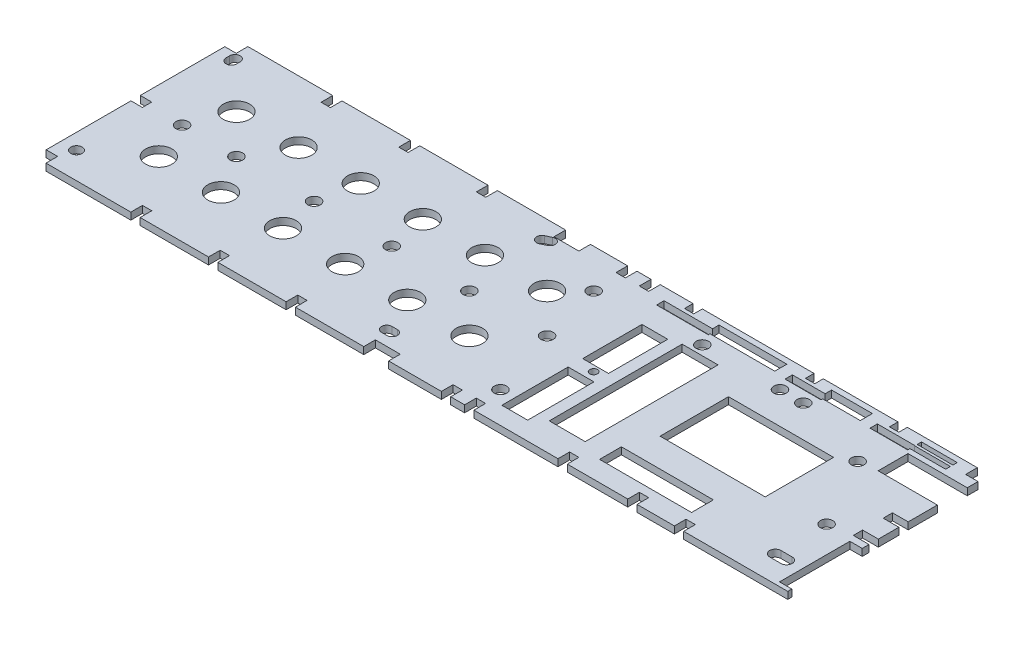
from build123d import *

# Parameters (mm, degrees)
SKETCH1_R           = 3.625773575
SKETCH1_R_2         = 8.5
SKETCH1_R_3         = 4
SKETCH1_W           = 59.227902108
SKETCH1_H           = 14.048666808
SKETCH1_W_2         = 16.602969863
SKETCH1_H_2         = 42.683012068
SKETCH1_R_4         = 2.466961033
SKETCH1_W_3         = 23.148371443
SKETCH1_H_3         = 85.569152371
SKETCH1_H_4         = 38.143470965
SKETCH1_W_4         = 67.68903098
SKETCH1_H_5         = 44.061727713
SKETCH1_W_5         = 22.994184748
SKETCH1_H_6         = 2.807717578
BOSS_EXTRUDE1_DEPTH = 4.5


with BuildPart() as part:
    # Sketch1 → Boss-Extrude1 (new body)
    with BuildSketch(Plane(origin=(0, 0, 0), x_dir=(1, 0, 0), z_dir=(0, 1, 0))):
        Polygon((62.002732312, 130), (7.385469745, 130), (7.385469745, 122.5), (0, 122.5), (0, 68.086598687), (7.385469745, 68.086598687), (7.385469745, 62.086598687), (0, 62.086598687), (0, 7.5), (7.385469745, 7.5), (7.385469745, 0), (62.002732312, 0), (62.002732312, 7.5), (68.002732312, 7.5), (68.002732312, 0), (112.032509858, 0), (112.032509858, 7.5), (118.032509858, 7.5), (118.032509858, 0), (161.992021545, 0), (161.992021545, 7.5), (167.992021545, 7.5), (167.992021545, 0), (211.980665765, 0), (211.980665765, 7.5), (227.980665765, 7.5), (227.980665765, 0), (261.969584498, 0), (261.969584498, 7.5), (267.969584498, 7.5), (267.969584498, 0), (276.920755035, 0), (276.920755035, 7.5), (282.920755035, 7.5), (282.920755035, 0), (337.020889406, 0), (337.020889406, 7.5), (343.020889406, 7.5), (343.020889406, 0), (381.96318409, 0), (381.96318409, 7.5), (387.96318409, 7.5), (387.96318409, 0), (411.996997426, 0), (411.996997426, 7.5), (417.996997426, 7.5), (417.996997426, 0), (485, 0), (485, 2.644509449), (477.041499419, 2.644509449), (477.041499419, 47.941310654), (485, 47.941310654), (485, 52.306927402), (474.892633063, 52.306927402), (474.892633063, 58.306927402), (485, 58.306927402), (485, 71.532960334), (474.892633063, 71.532960334), (474.892633063, 77.532960334), (485, 77.532960334), (485, 96.337752746), (446.852106169, 96.337752746), (446.852106169, 115.573963572), (485, 115.573963572), (485, 122.491965735), (477.041499419, 122.491965735), (477.041499419, 130), (431.99827146, 130), (431.99827146, 124.5), (425.99827146, 124.5), (425.99827146, 130), (377.887919693, 130), (377.887919693, 124.5), (371.887919693, 124.5), (371.887919693, 130), (300.000783582, 130), (300.000783582, 124.5), (294.000783582, 124.5), (294.000783582, 130), (272.916462339, 130), (272.916462339, 122.5), (266.916462339, 122.5), (266.916462339, 130), (257.911220927, 130), (257.911220927, 122.5), (251.911220927, 122.5), (251.911220927, 130), (227.980665765, 130), (227.980665765, 122.5), (211.980665765, 122.5), (211.980665765, 130), (167.992021545, 130), (167.992021545, 122.5), (161.992021545, 122.5), (161.992021545, 130), (118.032509858, 130), (118.032509858, 122.5), (112.032509858, 122.5), (112.032509858, 130), (68.002732312, 130), (68.002732312, 122.5), (62.002732312, 122.5), align=None)
        with Locations((10.034738544, 16.986969126)):
            Circle(SKETCH1_R, mode=Mode.SUBTRACT)
        with BuildLine():
            ThreePointArc((209.806870097, 13.639154798), (206.459055769, 16.986969126), (209.806870097, 20.334783454))
            Line((209.806870097, 20.334783454), (213.263594128, 20.334783454))
            ThreePointArc((213.263594128, 20.334783454), (216.611408456, 16.986969126), (213.263594128, 13.639154798))
            Line((213.263594128, 13.639154798), (209.806870097, 13.639154798))
        make_face(mode=Mode.SUBTRACT)
        with Locations((40.013782172, 40.004966614)):
            Circle(SKETCH1_R_2, mode=Mode.SUBTRACT)
        with Locations((80.013782172, 40.004966614)):
            Circle(SKETCH1_R_2, mode=Mode.SUBTRACT)
        with Locations((120.013782172, 40.004966614)):
            Circle(SKETCH1_R_2, mode=Mode.SUBTRACT)
        with Locations((160.013782172, 40.004966614)):
            Circle(SKETCH1_R_2, mode=Mode.SUBTRACT)
        with Locations((200.013782172, 40.004966614)):
            Circle(SKETCH1_R_2, mode=Mode.SUBTRACT)
        with Locations((240.013782172, 40.004966614)):
            Circle(SKETCH1_R_2, mode=Mode.SUBTRACT)
        with Locations((280, 20)):
            Circle(SKETCH1_R_3, mode=Mode.SUBTRACT)
        with Locations((380.411034456, 20.047190056)):
            Rectangle(SKETCH1_W, SKETCH1_H, mode=Mode.SUBTRACT)
        with BuildLine():
            ThreePointArc((460, 13.35335009), (456.366380964, 16.986969126), (460, 20.620588162))
            Line((460, 20.620588162), (467.25387069, 20.620588162))
            ThreePointArc((467.25387069, 20.620588162), (470.887489726, 16.986969126), (467.25387069, 13.35335009))
            Line((467.25387069, 13.35335009), (460, 13.35335009))
        make_face(mode=Mode.SUBTRACT)
        with Locations((297.476007111, 33.087211158)):
            Rectangle(SKETCH1_W_2, SKETCH1_H_2, mode=Mode.SUBTRACT)
        with Locations((300, 60)):
            Circle(SKETCH1_R_4, mode=Mode.SUBTRACT)
        with Locations((324.695299051, 61.075682891)):
            Rectangle(SKETCH1_W_3, SKETCH1_H_3, mode=Mode.SUBTRACT)
        with Locations((460, 50)):
            Circle(SKETCH1_R_3, mode=Mode.SUBTRACT)
        with Locations((30, 65)):
            Circle(SKETCH1_R_3, mode=Mode.SUBTRACT)
        with Locations((65, 65)):
            Circle(SKETCH1_R_3, mode=Mode.SUBTRACT)
        with Locations((115, 65)):
            Circle(SKETCH1_R_3, mode=Mode.SUBTRACT)
        with Locations((40.013782172, 90.004966614)):
            Circle(SKETCH1_R_2, mode=Mode.SUBTRACT)
        with Locations((80.013782172, 90.004966614)):
            Circle(SKETCH1_R_2, mode=Mode.SUBTRACT)
        with Locations((120.013782172, 90.004966614)):
            Circle(SKETCH1_R_2, mode=Mode.SUBTRACT)
        with Locations((165, 65)):
            Circle(SKETCH1_R_3, mode=Mode.SUBTRACT)
        with Locations((215, 65)):
            Circle(SKETCH1_R_3, mode=Mode.SUBTRACT)
        with Locations((160.013782172, 90.004966614)):
            Circle(SKETCH1_R_2, mode=Mode.SUBTRACT)
        with Locations((200.013782172, 90.004966614)):
            Circle(SKETCH1_R_2, mode=Mode.SUBTRACT)
        with Locations((240.013782172, 90.004966614)):
            Circle(SKETCH1_R_2, mode=Mode.SUBTRACT)
        with BuildLine():
            ThreePointArc((6.643144597, 119.0046284), (10.034738544, 122.396222347), (13.426332491, 119.0046284))
            Line((13.426332491, 119.0046284), (13.426332491, 116.692166772))
            ThreePointArc((13.426332491, 116.692166772), (10.034738544, 113.300572824), (6.643144597, 116.692166772))
            Line((6.643144597, 116.692166772), (6.643144597, 119.0046284))
        make_face(mode=Mode.SUBTRACT)
        with BuildLine():
            ThreePointArc((211.80063322, 121.675622046), (216.346514978, 120.055662103), (214.726555036, 115.509780345))
            Line((214.726555036, 115.509780345), (211.23636324, 113.853554186))
            ThreePointArc((211.23636324, 113.853554186), (206.690481482, 115.473514128), (208.310441424, 120.019395887))
            Line((208.310441424, 120.019395887), (211.80063322, 121.675622046))
        make_face(mode=Mode.SUBTRACT)
        with Locations((265, 65)):
            Circle(SKETCH1_R_3, mode=Mode.SUBTRACT)
        with Locations((297.476007111, 82.872796302)):
            Rectangle(SKETCH1_W_2, SKETCH1_H_4, mode=Mode.SUBTRACT)
        with Locations((391.187000473, 67.46144053)):
            Rectangle(SKETCH1_W_4, SKETCH1_H_5, mode=Mode.SUBTRACT)
        with Locations((435, 95)):
            Circle(SKETCH1_R_3, mode=Mode.SUBTRACT)
        with Locations((255, 105)):
            Circle(SKETCH1_R_3, mode=Mode.SUBTRACT)
        with Locations((320, 110)):
            Circle(SKETCH1_R_3, mode=Mode.SUBTRACT)
        Polygon((283.085809201, 117.5), (283.085809201, 122.235411884), (314.334759405, 122.235411884), (314.334759405, 126.4), (358.024535321, 126.4), (358.024535321, 118.592701195), (316.334759402, 118.592701195), (316.334759402, 117.5), align=None, mode=Mode.SUBTRACT)
        with Locations((370, 110)):
            Circle(SKETCH1_R_3, mode=Mode.SUBTRACT)
        with Locations((385, 110)):
            Circle(SKETCH1_R_3, mode=Mode.SUBTRACT)
        Polygon((365.730091621, 117.5), (365.730091621, 122.235411884), (386.832323877, 122.235411884), (386.832323877, 126.4), (413.096214621, 126.4), (413.096214621, 118.592701195), (388.832323875, 118.592701195), (388.832323875, 117.5), align=None, mode=Mode.SUBTRACT)
        Polygon((467.691755373, 118.935538121), (444.73163474, 118.935538121), (444.73163474, 117.5), (420.447958103, 117.5), (420.447958103, 122.235411884), (444.73163474, 122.235411884), (444.73163474, 122.021945082), (467.691755373, 122.021945082), align=None, mode=Mode.SUBTRACT)
        with Locations((456.228727114, 124.996141211)):
            Rectangle(SKETCH1_W_5, SKETCH1_H_6, mode=Mode.SUBTRACT)
    extrude(amount=-BOSS_EXTRUDE1_DEPTH)


solid = part.part
